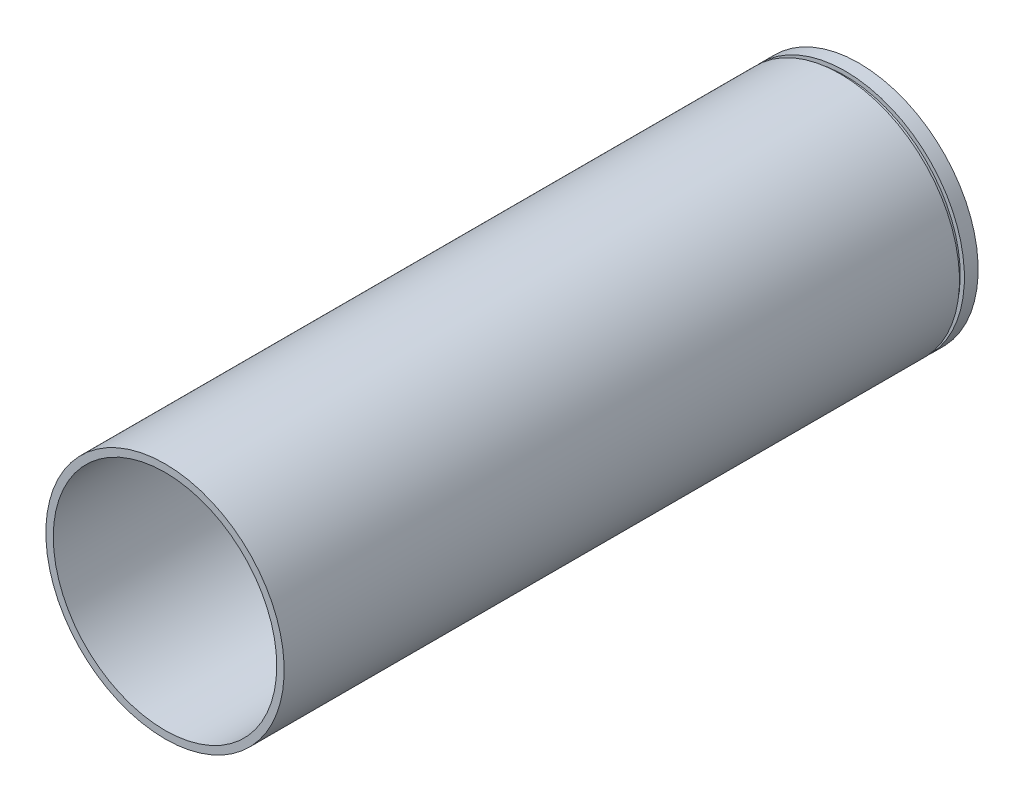
from build123d import *


with BuildPart() as part:
    # Sketch1 → Revolve2 (revolve)
    with BuildSketch(Plane(origin=(0, 0, 0), x_dir=(0, 0, -1), z_dir=(1, 0, 0))):
        Polygon((283.311529954, 101.3), (295, 101.3), (295, 95), (-295, 95), (-295, 101.3), (279.114653082, 101.3), (279.114653082, 97.779061503), (283.311529954, 97.779061503), align=None)
    revolve(axis=Axis((0, 0, 63.929601425), (0, 0, -1)))


solid = part.part
